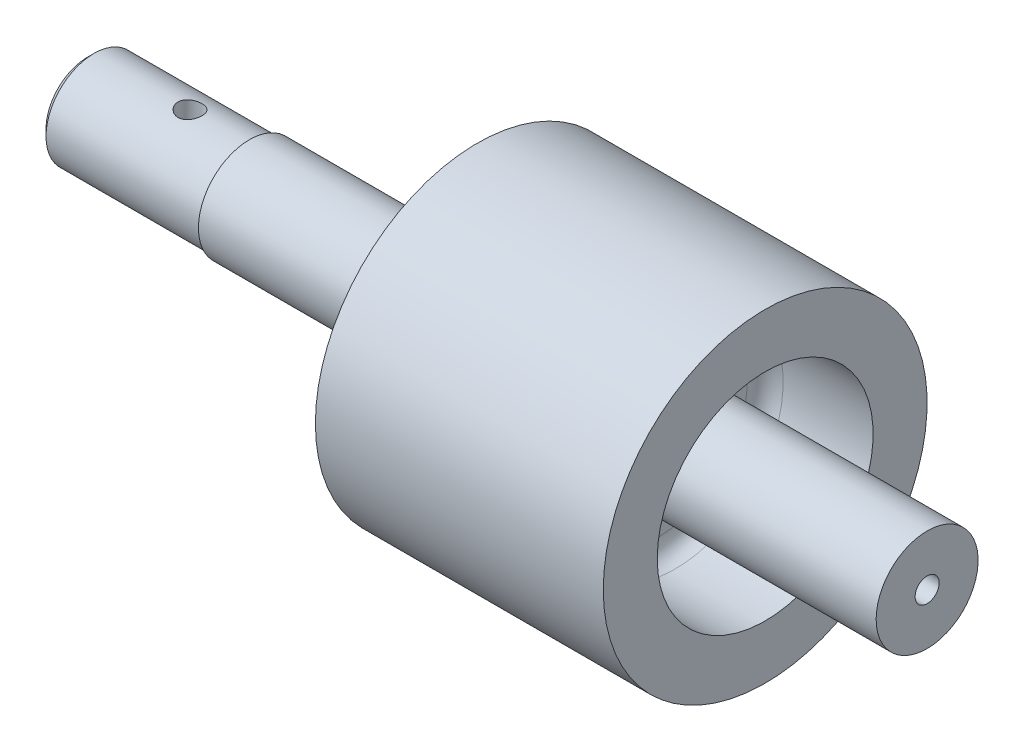
from build123d import *

# Parameters (mm, degrees)
FILLET_4_R      = 3
F_4_0MM_4_D     = 4
F_4_0MM_4_DEPTH = 8
F_4_0MM_4_TIP   = 1.201721238
F_4_0MM_5_D     = 4
F_4_0MM_5_DEPTH = 7
F_4_0MM_5_TIP   = 1.201721238


# Read off the part's stored shape, not the designer's step: M16 机械螺纹 螺柱1
with BuildPart() as part:
    # 草图1 → 旋转1 (revolve)
    with BuildSketch(Plane.XY, mode=Mode.PRIVATE) as revolve_1_sk:
        Polygon((0, 0), (0, 8), (27, 8), (27, 8.5), (83, 8.5), (83, 18), (65, 18), (65, 27), (113, 27), (113, 18), (95, 18), (95, 8.5), (140, 8.5), (140, 0), align=None)
    revolve(revolve_1_sk.sketch.rotate(Axis((0, 0, 0), (1, 0, 0)), 90), axis=Axis((0, 0, 0), (1, 0, 0)))

    # 圆角4
    fillet_4_edges = [part.edges().sort_by_distance(p)[0] for p in [
        (95, 0, -8.5),
        (95, 0, -18),
        (83, 0, -18),
        (83, 0, -8.5),
    ]]
    fillet(fillet_4_edges, radius=FILLET_4_R)

    # M16 机械螺纹 螺柱1 outline → M16 机械螺纹 螺柱1 (revolve, cut)
    with BuildSketch(Plane.YX):
        Polygon((8, 1.0825), (6.9175, 0), (8, 0), align=None)
    revolve(axis=Axis((0, 0, 0), (1, 0, 0)), mode=Mode.SUBTRACT)

    # Ø4.0mm 暗销孔4
    with Locations(Plane(origin=(17.1, 8, 0), x_dir=(0, 0, 1), z_dir=(0, 1, 0))):
        with Locations((0, 0)):
            Hole(F_4_0MM_4_D / 2, depth=F_4_0MM_4_DEPTH)
            with Locations((0, 0, -(F_4_0MM_4_DEPTH + F_4_0MM_4_TIP / 2))):  # 118° drill point
                Cone(0, F_4_0MM_4_D / 2, F_4_0MM_4_TIP, mode=Mode.SUBTRACT)

    # Ø4.0mm 暗销孔5
    with Locations(Plane(origin=(140, 0, 0), x_dir=(0, 0, -1), z_dir=(1, 0, 0))):
        with Locations((0, 0)):
            Hole(F_4_0MM_5_D / 2, depth=F_4_0MM_5_DEPTH)
            with Locations((0, 0, -(F_4_0MM_5_DEPTH + F_4_0MM_5_TIP / 2))):  # 118° drill point
                Cone(0, F_4_0MM_5_D / 2, F_4_0MM_5_TIP, mode=Mode.SUBTRACT)


solid = part.part
